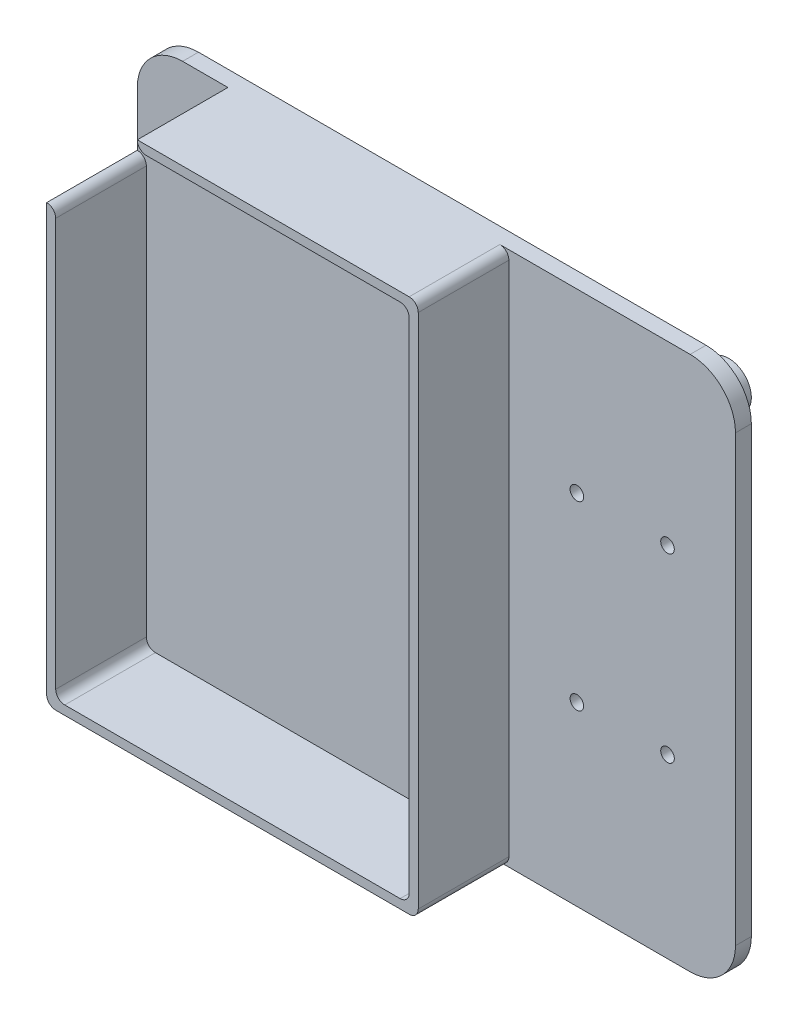
from build123d import *

# Parameters (mm, degrees)
SKETCH_1_W                                 = 50
SKETCH_1_H                                 = 118
EXTRUDE_1_DEPTH                            = 3.5
SKETCH_3_R                                 = 1.5
CUT_EXTRUDE_1_DEPTH                        = 65.1735927
MIRROR_1_AT_THE_SECOND_PLANE_COPY_1_SKET_R = 1.5
MIRROR_1_AT_THE_SECOND_PLANE_COPY_1_DEPTH  = 65.1735927
SKETCH_4_W                                 = 3.5
SKETCH_4_H                                 = 118
EXTRUDE_2_DEPTH                            = 82
EXTRUDE_4_OUTLINE_W                        = 82
EXTRUDE_4_OUTLINE_H                        = 118
EXTRUDE_4_OUTLINE_W_2                      = 78
EXTRUDE_4_OUTLINE_H_2                      = 114
EXTRUDE_4_DEPTH                            = 20
SKETCH_6_W                                 = 2
SKETCH_6_H                                 = 20
SKETCH_6_W_2                               = 18
CUT_EXTRUDE_2_DEPTH                        = 20
SKETCH_7_W                                 = 18
SKETCH_7_H                                 = 20
SKETCH_7_W_2                               = 2
CUT_EXTRUDE_3_DEPTH                        = 20
FILLET_1_R                                 = 10
FILLET_2_R                                 = 2
FILLET_3_R                                 = 2
SKETCH_8_R                                 = 5
EXTRUDE_3_DEPTH                            = 5
SKETCH_9_R                                 = 5
EXTRUDE_4_2_DEPTH                          = 5


# Read off the part's stored shape, not the designer's step: 拉伸-薄壁4
with BuildPart() as part:
    # 草图1 → 凸台-拉伸1 (new body)
    with BuildSketch(Plane.XY):
        Rectangle(SKETCH_1_W, SKETCH_1_H)
    extrude(amount=EXTRUDE_1_DEPTH)

    # 草图3 → 切除-拉伸1 (cut, through all)
    with BuildSketch(Plane.XY.offset(3.5)):
        with Locations((-10, 20)):
            Circle(SKETCH_3_R)
    cut_extrude_1 = extrude(amount=-CUT_EXTRUDE_1_DEPTH, mode=Mode.SUBTRACT)

    # 镜向1: 切除-拉伸1 across plane
    add(cut_extrude_1.mirror(Plane(origin=(0, 0, 0), x_dir=(0, 0, 1), z_dir=(1, 0, 0))), mode=Mode.SUBTRACT)

    # 镜向1 at the second plane: 切除-拉伸1 across plane
    add(cut_extrude_1.mirror(Plane.ZX), mode=Mode.SUBTRACT)

    # 镜向1 at the second plane copy 1 sket → 镜向1 at the second plane copy 1 (cut, through all)
    with BuildSketch(Plane(origin=(0, 0, 3.5), x_dir=(-1, 0, 0), z_dir=(0, 0, 1))):
        with Locations((-10, 20)):
            Circle(MIRROR_1_AT_THE_SECOND_PLANE_COPY_1_SKET_R)
    extrude(amount=-MIRROR_1_AT_THE_SECOND_PLANE_COPY_1_DEPTH, mode=Mode.SUBTRACT)

    # 草图4 → 凸台-拉伸2 (add)
    with BuildSketch(Plane.ZY.offset(25)):
        with Locations((1.75, 0)):
            Rectangle(SKETCH_4_W, SKETCH_4_H)
    extrude(amount=EXTRUDE_2_DEPTH)

    # Extrude 4 outline → Extrude 4 (add)
    with BuildSketch(Plane.XY.offset(3.5)):
        with Locations((-66, 0)):
            Rectangle(EXTRUDE_4_OUTLINE_W, EXTRUDE_4_OUTLINE_H)
        with Locations((-66, 0)):
            Rectangle(EXTRUDE_4_OUTLINE_W_2, EXTRUDE_4_OUTLINE_H_2, mode=Mode.SUBTRACT)
    extrude(amount=EXTRUDE_4_DEPTH)

    # 草图6 → 切除-拉伸2 (cut)
    with BuildSketch(Plane.XZ.offset(-57)):
        with Locations((-106, 13.5)):
            Rectangle(SKETCH_6_W, SKETCH_6_H)
        with Locations((-96, 13.5)):
            Rectangle(SKETCH_6_W_2, SKETCH_6_H)
    extrude(amount=CUT_EXTRUDE_2_DEPTH, mode=Mode.SUBTRACT)

    # 草图7 → 切除-拉伸3 (cut)
    with BuildSketch(Plane.XZ.offset(-57)):
        with Locations((-96, 13.5)):
            Rectangle(SKETCH_7_W, SKETCH_7_H)
        with Locations((-106, 13.5)):
            Rectangle(SKETCH_7_W_2, SKETCH_7_H)
    extrude(amount=-CUT_EXTRUDE_3_DEPTH, mode=Mode.SUBTRACT)

    # 圆角1
    fillet_1_edges = [part.edges().sort_by_distance(p)[0] for p in [
        (25, -59, 1.75),
        (25, 59, 1.75),
        (-107, 59, 1.75),
    ]]
    fillet(fillet_1_edges, radius=FILLET_1_R)

    # 圆角2
    fillet_2_edges = [part.edges().sort_by_distance(p)[0] for p in [
        (-87, 57, 13.5),
        (-107, -59, 11.75),
        (-25, -59, 13.5),
        (-25, 59, 13.5),
        (-105, 37, 13.5),
    ]]
    fillet(fillet_2_edges, radius=FILLET_2_R - 0.0001)  # a hair under: the kernel refuses the full size

    # 圆角3
    fillet_3_edges = [part.edges().sort_by_distance(p)[0] for p in [
        (-27, 57, 13.5),
        (-105, -57, 13.5),
        (-27, -57, 13.5),
    ]]
    fillet(fillet_3_edges, radius=FILLET_3_R)

    # 草图8 → 凸台-拉伸3 (add)
    with BuildSketch(Plane(origin=(0, 0, 0), x_dir=(-1, 0, 0), z_dir=(0, 0, -1))):
        with Locations(Location((-15, 49, 0), (0, 0, 180))):
            Circle(SKETCH_8_R)
        with Locations(Location((97, 49, 0), (0, 0, 180))):
            Circle(SKETCH_8_R)
        with Locations(Location((-15, -49, 0), (0, 0, 180))):
            Circle(SKETCH_8_R)
        with Locations(Location((97, -49, 0), (0, 0, 180))):
            Circle(SKETCH_8_R)
    extrude(amount=EXTRUDE_3_DEPTH)

    # 草图9 → Extrude 4 2 (add)
    with BuildSketch(Plane(origin=(0, 0, 0), x_dir=(-1, 0, 0), z_dir=(0, 0, -1))):
        with Locations(Location((41, 49, 0), (0, 0, 180))):
            Circle(SKETCH_9_R)
        with Locations(Location((41, -49, 0), (0, 0, 180))):
            Circle(SKETCH_9_R)
    extrude(amount=EXTRUDE_4_2_DEPTH)


solid = part.part
